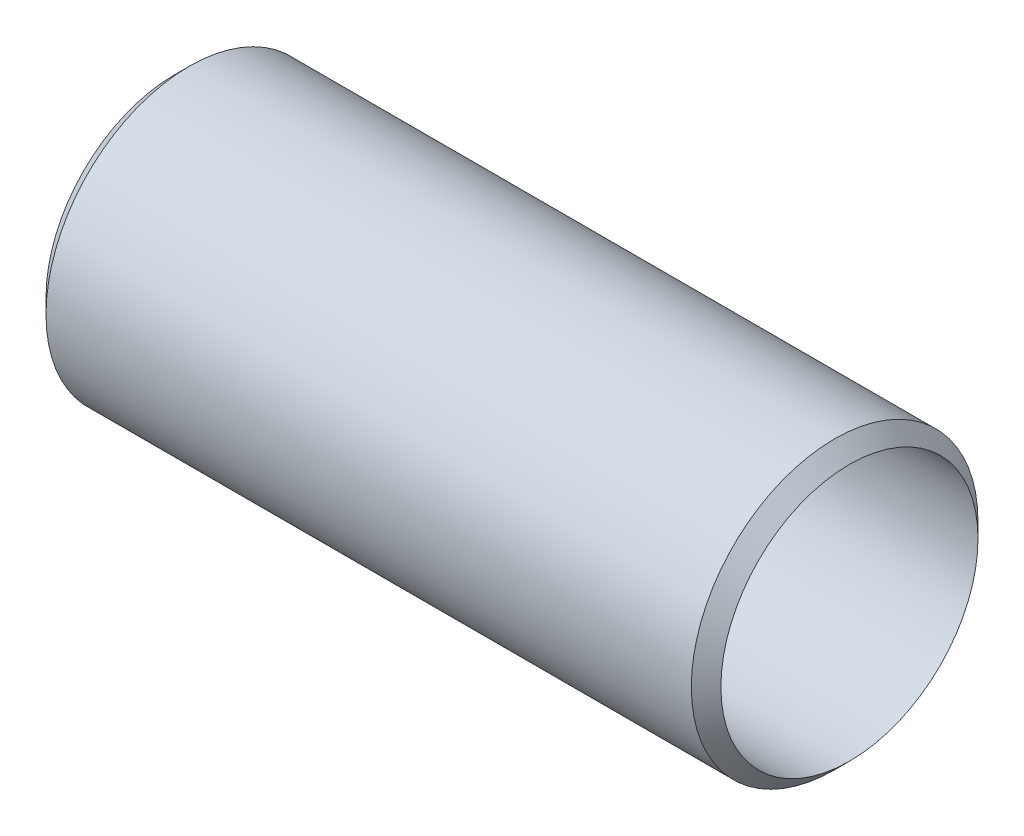
from build123d import *

# Parameters (mm, degrees)
BOSS_EXTRUDE1_DEPTH      = 66.675
BOSS_EXTRUDE1_DEPTH_BACK = 66.675
SKETCH1_R                = 28.321
F_97_2_DIAMETER_HOLE1_D  = 50.8
CHAMFER1_SIZE            = 2.921


with BuildPart() as part:
    # Sketch1 → Boss-Extrude1 (new, two sides: drawn at the far end of the back side and taken through both)
    with BuildSketch(Plane(origin=(0, 0, 0), x_dir=(0, 0, -1), z_dir=(1, 0, 0)).offset(-BOSS_EXTRUDE1_DEPTH_BACK)):
        Circle(SKETCH1_R)
    extrude(amount=BOSS_EXTRUDE1_DEPTH + BOSS_EXTRUDE1_DEPTH_BACK)

    # #97 (2) Diameter Hole1 (through all)
    with Locations(Plane(origin=(66.675, 0, 0), x_dir=(0, 0, -1), z_dir=(1, 0, 0))):
        with Locations((0, 0)):
            Hole(F_97_2_DIAMETER_HOLE1_D / 2)

    # Chamfer1
    chamfer1_edges = [part.edges().sort_by_distance(p)[0] for p in [
        (66.675, 0, 28.321),
        (-66.675, 0, 28.321),
    ]]
    chamfer(chamfer1_edges, length=CHAMFER1_SIZE - 0.0001)  # a hair under: the kernel refuses the full size


solid = part.part
